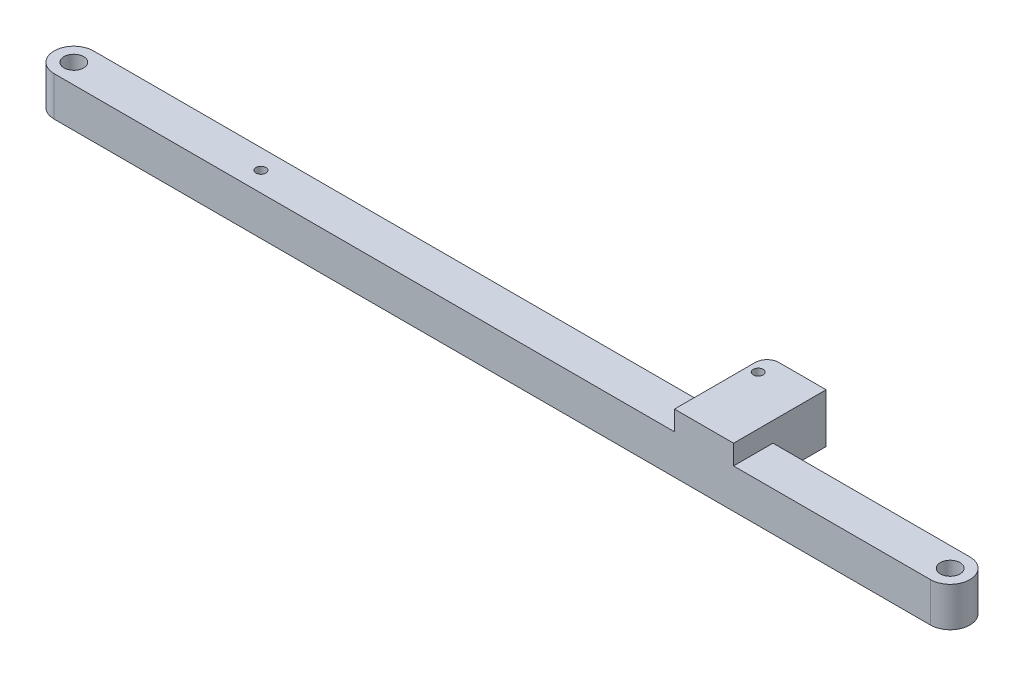
from build123d import *

# Parameters (mm, degrees)
SKETCH2_R           = 6.35
SKETCH2_R_2         = 3.175
BOSS_EXTRUDE1_DEPTH = 25.4
BOSS_EXTRUDE7_DEPTH = 44.45
SKETCH15_R          = 3.175
CUT_EXTRUDE3_DEPTH  = 583.921699287
SKETCH14_W          = 38.1
SKETCH14_H          = 25.4
BOSS_EXTRUDE8_DEPTH = 12.7
SKETCH17_W          = 38.1
SKETCH17_H          = 10.16
CUT_EXTRUDE4_DEPTH  = 583.921699287
FILLET1_R           = 7.62


with BuildPart() as part:
    # Sketch2 → Boss-Extrude1 (new body)
    with BuildSketch(Plane(origin=(0, 0, 0), x_dir=(1, 0, 0), z_dir=(0, 1, 0))):
        with BuildLine():
            ThreePointArc((0, 25.4), (-12.7, 12.7), (0, 0))
            Line((0, 0), (565.15, 0))
            ThreePointArc((565.15, 0), (577.85, 12.7), (565.15, 25.4))
            Line((565.15, 25.4), (0, 25.4))
        make_face()
        with Locations((0, 12.7)):
            Circle(SKETCH2_R, mode=Mode.SUBTRACT)
        with Locations((120.65, 12.7)):
            Circle(SKETCH2_R_2, mode=Mode.SUBTRACT)
        with Locations((565.15, 12.7)):
            Circle(SKETCH2_R, mode=Mode.SUBTRACT)
    extrude(amount=BOSS_EXTRUDE1_DEPTH)

    # Sketch12 → Boss-Extrude7 (add)
    with BuildSketch(Plane(origin=(0, 0, -25.4), x_dir=(-1, 0, 0), z_dir=(0, 0, -1))):
        Polygon((-438.15, 6.35), (-400.05, 6.35), (-400.05, 12.7), (-431.8, 12.7), (-431.8, 31.75), (-400.05, 31.75), (-400.05, 38.1), (-438.15, 38.1), align=None)
    extrude(amount=BOSS_EXTRUDE7_DEPTH)

    # Sketch15 → Cut-Extrude3 (cut, through all)
    with BuildSketch(Plane.XZ.offset(-6.35)):
        with Locations((406.4, -47.625)):
            Circle(SKETCH15_R)
    extrude(amount=-CUT_EXTRUDE3_DEPTH, mode=Mode.SUBTRACT)

    # Sketch14 → Boss-Extrude8 (add)
    with BuildSketch(Plane(origin=(0, 25.4, 0), x_dir=(1, 0, 0), z_dir=(0, 1, 0))):
        with Locations((419.1, 12.7)):
            Rectangle(SKETCH14_W, SKETCH14_H)
    extrude(amount=BOSS_EXTRUDE8_DEPTH)

    # Sketch17 → Cut-Extrude4 (cut, through all)
    with BuildSketch(Plane.XZ.offset(-6.35)):
        with Locations((419.1, -64.77)):
            Rectangle(SKETCH17_W, SKETCH17_H)
    extrude(amount=-CUT_EXTRUDE4_DEPTH, mode=Mode.SUBTRACT)

    # Fillet1
    fillet1_edges = [part.edges().sort_by_distance(p)[0] for p in [
        (400.05, 34.925, -59.69),
        (400.05, 9.525, -59.69),
    ]]
    fillet(fillet1_edges, radius=FILLET1_R)


solid = part.part
